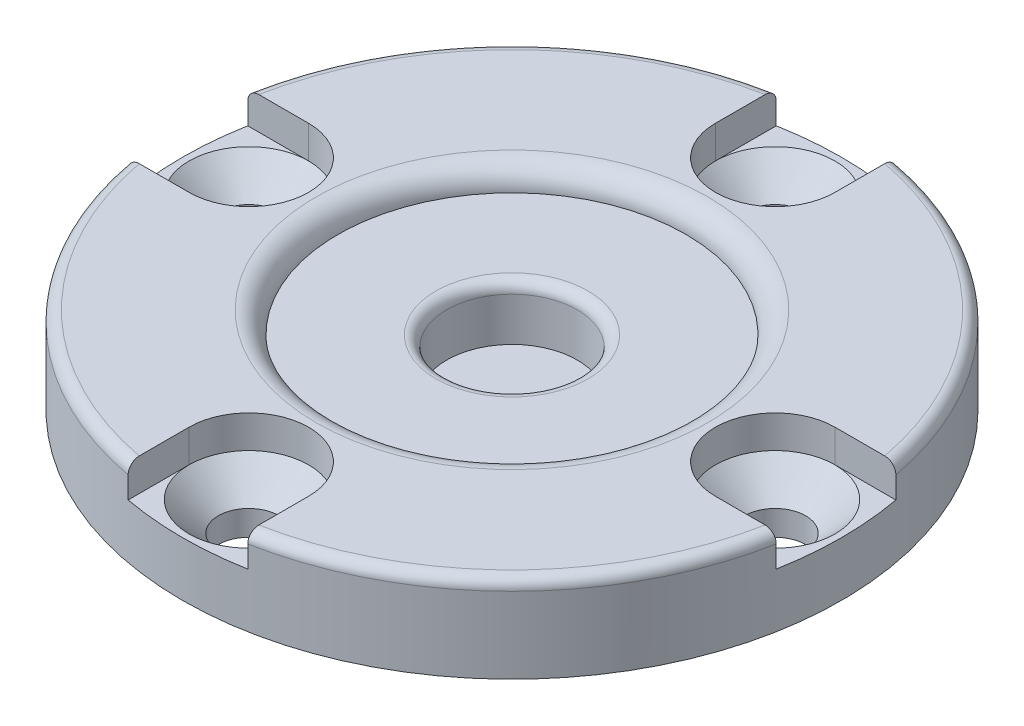
from build123d import *

# Parameters (mm, degrees)
SKETCH1_R                                      = 15.15
BOSS_EXTRUDE1_DEPTH                            = 4
SKETCH4_R                                      = 8
CUT_EXTRUDE3_DEPTH                             = 1
SKETCH5_R                                      = 3
CUT_EXTRUDE4_DEPTH                             = 2.5
FILLET1_R                                      = 1
FILLET2_R                                      = 0.5
FILLET3_R                                      = 0.5
CUT_EXTRUDE5_START                             = -1.5
CUT_EXTRUDE5_DEPTH                             = 1.5
CSK_FOR_M2_5_FLAT_HEAD_MACHINE_SCREW1_AT_COUNT = 2
CSK_FOR_M2_5_FLAT_HEAD_MACHINE_SCREW1_AT_PITCH = 17.111984105
CSK_FOR_M2_5_FLAT_HEAD_MACHINE_SCREW_2_COUNT   = 2
CSK_FOR_M2_5_FLAT_HEAD_MACHINE_SCREW_2_PITCH   = 17.111984105
CSK_FOR_M2_5_FLAT_HEAD_MACHINE_SCREW_3_COUNT   = 2
CSK_FOR_M2_5_FLAT_HEAD_MACHINE_SCREW_3_PITCH   = 24.2


with BuildPart() as part:
    # Sketch1 → Boss-Extrude1 (new body)
    with BuildSketch(Plane(origin=(0, 0, 0), x_dir=(1, 0, 0), z_dir=(0, 1, 0))):
        with Locations(Location((0, 0, 0), (0, 0, 270))):
            Circle(SKETCH1_R)
    extrude(amount=BOSS_EXTRUDE1_DEPTH)

    # Sketch4 → Cut-Extrude3 (cut)
    with BuildSketch(Plane(origin=(0, 4, 0), x_dir=(1, 0, 0), z_dir=(0, 1, 0))):
        with Locations(Location((0, 0, 0), (0, 0, 270))):
            Circle(SKETCH4_R)
    extrude(amount=-CUT_EXTRUDE3_DEPTH, mode=Mode.SUBTRACT)

    # Sketch5 → Cut-Extrude4 (cut)
    with BuildSketch(Plane(origin=(0, 3, 0), x_dir=(1, 0, 0), z_dir=(0, 1, 0))):
        with Locations(Location((0, 0, 0), (0, 0, 270))):
            Circle(SKETCH5_R)
    extrude(amount=-CUT_EXTRUDE4_DEPTH, mode=Mode.SUBTRACT)

    # Fillet1
    fillet1_edges = [part.edges().sort_by_distance(p)[0] for p in [
        (0, 4, -8),
    ]]
    fillet(fillet1_edges, radius=FILLET1_R - 0.0001)  # a hair under: the kernel refuses the full size

    # Fillet2
    fillet2_edges = [part.edges().sort_by_distance(p)[0] for p in [
        (0, 3, -3),
    ]]
    fillet(fillet2_edges, radius=FILLET2_R)

    # Fillet3
    fillet3_edges = [part.edges().sort_by_distance(p)[0] for p in [
        (0, 4, -15.15),
    ]]
    fillet(fillet3_edges, radius=FILLET3_R)

    # Sketch2<2> → Cut-Extrude5 (cut)
    with BuildSketch(Plane(origin=(0, 4, 0), x_dir=(1, 0, 0), z_dir=(0, 1, 0)).offset(CUT_EXTRUDE5_START)):
        with BuildLine():
            Line((-12.1, 2.75), (-14.898322053, 2.75))
            ThreePointArc((-14.898322053, 2.75), (-15.15, 0), (-14.898322053, -2.75))
            Line((-14.898322053, -2.75), (-12.1, -2.75))
            ThreePointArc((-12.1, -2.75), (-9.35, 0), (-12.1, 2.75))
        make_face()
        with BuildLine():
            Line((-2.75, -12.1), (-2.75, -14.898322053))
            ThreePointArc((-2.75, -14.898322053), (0, -15.15), (2.75, -14.898322053))
            Line((2.75, -14.898322053), (2.75, -12.1))
            ThreePointArc((2.75, -12.1), (0, -9.35), (-2.75, -12.1))
        make_face()
        with BuildLine():
            ThreePointArc((15.15, 0), (15.086949312, 1.380746337), (14.898322053, 2.75))
            Line((14.898322053, 2.75), (12.1, 2.75))
            ThreePointArc((12.1, 2.75), (9.35, 0), (12.1, -2.75))
            Line((12.1, -2.75), (14.898322053, -2.75))
            ThreePointArc((14.898322053, -2.75), (15.086949312, -1.380746337), (15.15, 0))
        make_face()
        with BuildLine():
            ThreePointArc((-2.75, 12.1), (0, 9.35), (2.75, 12.1))
            Line((2.75, 12.1), (2.75, 14.898322053))
            ThreePointArc((2.75, 14.898322053), (0, 15.15), (-2.75, 14.898322053))
            Line((-2.75, 14.898322053), (-2.75, 12.1))
        make_face()
    extrude(amount=CUT_EXTRUDE5_DEPTH, mode=Mode.SUBTRACT)

    # Sketch7 → CSK for M2.5 Flat Head Machine Screw1 (revolve, cut)
    with BuildSketch(Plane(origin=(0, 2.5, -12.1), x_dir=(0, 0, 1), z_dir=(1, 0, 0))):
        Polygon((0, 0), (0, 2.5), (1.4, 2.5), (1.4, 1.35), (2.75, 0), align=None)
    csk_for_m2_5_flat_head_machine_screw1 = revolve(axis=Axis((0, 8.85, -12.1), (0, -1, 0)), mode=Mode.SUBTRACT)

    # CSK for M2.5 Flat Head Machine Screw1 at: CSK for M2.5 Flat Head Machine Screw1 ×2
    with Locations(*[Vector(-0.7071067811865512, 0, 0.7071067811865439) * (i * CSK_FOR_M2_5_FLAT_HEAD_MACHINE_SCREW1_AT_PITCH) for i in range(1, CSK_FOR_M2_5_FLAT_HEAD_MACHINE_SCREW1_AT_COUNT)]):
        add(csk_for_m2_5_flat_head_machine_screw1, mode=Mode.SUBTRACT)

    # CSK for M2.5 Flat Head Machine Screw 2: CSK for M2.5 Flat Head Machine Screw1 ×2
    with Locations(*[Vector(0.7071067811865464, 0, 0.7071067811865488) * (i * CSK_FOR_M2_5_FLAT_HEAD_MACHINE_SCREW_2_PITCH) for i in range(1, CSK_FOR_M2_5_FLAT_HEAD_MACHINE_SCREW_2_COUNT)]):
        add(csk_for_m2_5_flat_head_machine_screw1, mode=Mode.SUBTRACT)

    # CSK for M2.5 Flat Head Machine Screw 3: CSK for M2.5 Flat Head Machine Screw1 ×2
    with Locations(*[(0, 0, i * CSK_FOR_M2_5_FLAT_HEAD_MACHINE_SCREW_3_PITCH) for i in range(1, CSK_FOR_M2_5_FLAT_HEAD_MACHINE_SCREW_3_COUNT)]):
        add(csk_for_m2_5_flat_head_machine_screw1, mode=Mode.SUBTRACT)


solid = part.part
